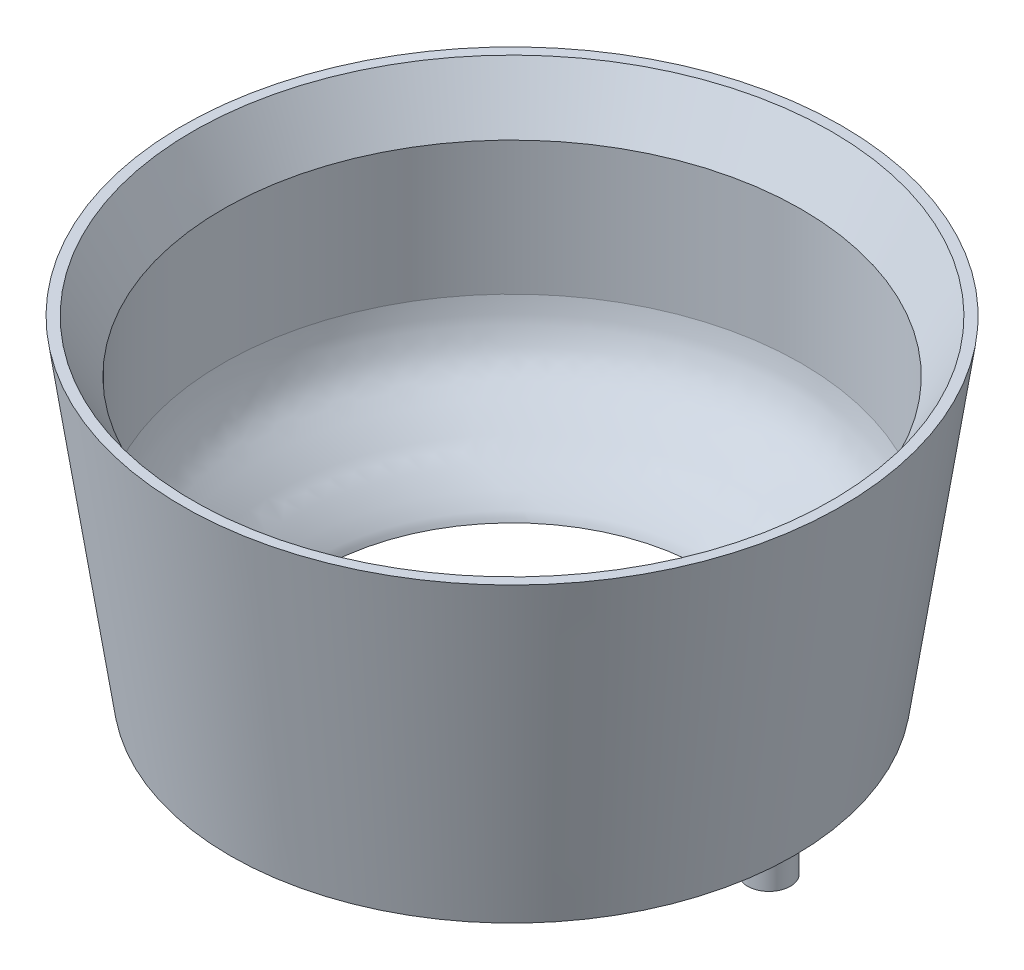
from build123d import *
from OCP.BRepAlgoAPI import BRepAlgoAPI_Cut
from OCP.TopTools import TopTools_ListOfShape

# Parameters (mm, degrees)
SKETCH4_R                       = 3
BOSS_EXTRUDE1_DEPTH             = 2
SKETCH4_2_R                     = 3
BOSS_EXTRUDE3_DEPTH             = 2
BOSS_EXTRUDE3_DIRECTION_2_REACH = 82.882
SKETCH13_R                      = 1.5
CUT_EXTRUDE1_DEPTH              = 6
SKETCH14_R                      = 2
CUT_EXTRUDE2_DEPTH              = 0.5
CHAMFER3_SIZE                   = 0.55


with BuildPart() as part:
    # Sketch2 → Revolve6 (revolve)
    with BuildSketch(Plane(origin=(0, 0, 0), x_dir=(0, 0, -1), z_dir=(1, 0, 0))):
        with BuildLine():
            Line((26.5077562, 274.996982717), (26.5077562, 273.848618937))
            Line((26.5077562, 273.848618937), (39.220771912, 273.848618937))
            Line((39.220771912, 273.848618937), (46.181267187, 321.561079724))
            Line((46.181267187, 321.561079724), (44.775299462, 321.561079724))
            Line((44.775299462, 321.561079724), (40.547674755, 314.238618937))
            Line((40.547674755, 314.238618937), (40.547674755, 295.540718438))
            add(Edge.make_bspline(
                [(40.547674755, 295.540718438), (40.447740466, 295.012709616), (40.292777353, 293.970757619), (39.930889755, 292.587532753), (39.516186416, 291.581451359), (39.108370782, 290.57804728), (38.439698054, 289.316986818), (37.331416086, 288.032583079), (36.368363881, 287.115418474), (35.630231264, 286.340079673), (35.016472726, 285.762737126), (34.394259795, 285.247169223), (33.635524662, 284.556557999), (32.920361334, 283.771384038), (32.129651901, 282.986073936), (31.485241784, 282.459482323), (30.914997208, 281.963476573), (30.371700346, 281.391298159), (29.782796159, 280.80462685), (29.227584581, 280.262154528), (28.724752618, 279.674853681), (28.180386253, 279.039651715), (27.651838315, 278.470209992), (27.308145935, 277.876839187), (26.995230081, 277.127164256), (26.597952618, 276.164510632), (26.464811583, 275.470548141), (26.5077562, 274.996982717)],
                knots=[0, 0, 0, 0, 0.062544048, 0.125088096, 0.156360121, 0.187632145, 0.250176193, 0.312720241, 0.375264289, 0.406536313, 0.437808337, 0.469080362, 0.500352386, 0.562896434, 0.594168458, 0.625440482, 0.656712506, 0.68798453, 0.719256554, 0.750528579, 0.781800603, 0.813072627, 0.844344651, 0.875616675, 0.906888699, 0.938160723, 1.000704771, 1.000704771, 1.000704771, 1.000704771], degree=3))
        make_face()
    revolve(axis=Axis((0, 5, 0), (0, 1, 0)))

    # Sketch4 → Boss-Extrude1 (add)
    with BuildSketch(Plane.XZ.offset(-273.848618937)):
        with Locations(Location((-31.176914536, 18, 0), (0, 0, 270))):
            Circle(SKETCH4_R)
        with Locations(Location((36, 0, 0), (0, 0, 270))):
            Circle(SKETCH4_R)
    extrude(amount=BOSS_EXTRUDE1_DEPTH)

    # Sketch7 → Revolve7 (revolve)
    with BuildSketch(Plane(origin=(0, 0, 0), x_dir=(0, 0, -1), z_dir=(1, 0, 0))):
        with BuildLine():
            Line((39.220771912, 273.848618937), (39.220771912, 272.319355593))
            ThreePointArc((39.220771912, 272.319355593), (32.873157949, 273.157923648), (26.5077562, 273.848618937))
            Line((26.5077562, 273.848618937), (26.5077562, 274.348618937))
            Line((26.5077562, 274.348618937), (39.220771912, 274.348618937))
            Line((39.220771912, 274.348618937), (39.220771912, 273.848618937))
        make_face()
    revolve(axis=Axis((0, 5, 0), (0, 1, 0)))


with BuildPart() as cut_revolve3_tool:
    # Sketch12 → Cut-Revolve3 (revolve)
    with BuildSketch(Plane(origin=(0, 0, 0), x_dir=(0, 0, -1), z_dir=(1, 0, 0))):
        with BuildLine():
            Line((26.0877562, 277.404557538), (26.0877562, 267.404557538))
            Line((26.0877562, 267.404557538), (40.0877562, 267.404557538))
            Line((40.0877562, 267.404557538), (40.0877562, 275.730375326))
            ThreePointArc((40.0877562, 275.730375326), (33.098343341, 276.655999187), (26.0877562, 277.404557538))
        make_face()
    revolve(axis=Axis((0, 5, 0), (0, 1, 0)))


with BuildPart() as part_1:
    add(part.part)

    # Cut-Revolve3: cut by cut_revolve3_tool, with a tolerance
    cut_revolve3_stock = TopTools_ListOfShape()
    cut_revolve3_stock.Append(part_1.part.wrapped)
    cut_revolve3_tools = TopTools_ListOfShape()
    cut_revolve3_tools.Append(cut_revolve3_tool.part.wrapped)
    cut_revolve3_cut = BRepAlgoAPI_Cut()
    cut_revolve3_cut.SetArguments(cut_revolve3_stock)
    cut_revolve3_cut.SetTools(cut_revolve3_tools)
    cut_revolve3_cut.SetFuzzyValue(0.00001)
    cut_revolve3_cut.Build()
    add(Compound.cast(cut_revolve3_cut.Shape()).solids(), mode=Mode.REPLACE)

    # Sketch4<2> → Boss-Extrude3 (add)
    with BuildSketch(Plane.XZ.offset(-273.848618937)):
        with Locations(Location((-31.176914536, 18, 0), (0, 0, 270))):
            Circle(SKETCH4_2_R)
        with Locations(Location((36, 0, 0), (0, 0, 270))):
            Circle(SKETCH4_2_R)
    extrude(amount=BOSS_EXTRUDE3_DEPTH)

    # Sketch4<2> → Boss-Extrude3 direction 2 (add, up to next)
    with BuildSketch(Plane.XZ.offset(-273.848618937), mode=Mode.PRIVATE) as boss_extrude3_direction_2_sk1:
        with Locations(Location((-31.176914536, 18, 0), (0, 0, 270))):
            Circle(SKETCH4_2_R)
    boss_extrude3_direction_2_tool1 = extrude(boss_extrude3_direction_2_sk1.sketch, amount=-BOSS_EXTRUDE3_DIRECTION_2_REACH, mode=Mode.PRIVATE) - part_1.part
    # Sketch4<2> → Boss-Extrude3 direction 2 (add, up to next)
    with BuildSketch(Plane.XZ.offset(-273.848618937), mode=Mode.PRIVATE) as boss_extrude3_direction_2_sk2:
        with Locations(Location((36, 0, 0), (0, 0, 270))):
            Circle(SKETCH4_2_R)
    boss_extrude3_direction_2_tool2 = extrude(boss_extrude3_direction_2_sk2.sketch, amount=-BOSS_EXTRUDE3_DIRECTION_2_REACH, mode=Mode.PRIVATE) - part_1.part
    add(boss_extrude3_direction_2_tool1.solids().sort_by_distance((-31.176915, 273.848619, 18))[0])
    add(boss_extrude3_direction_2_tool2.solids().sort_by_distance((36, 273.848619, 0))[0])

    # Sketch13 → Cut-Extrude1 (cut)
    with BuildSketch(Plane.XZ.offset(-271.848618937)):
        with Locations(Location((-31.176914536, 18, 0), (0, 0, 270))):
            Circle(SKETCH13_R)
        with Locations(Location((36, 0, 0), (0, 0, 270))):
            Circle(SKETCH13_R)
    extrude(amount=-CUT_EXTRUDE1_DEPTH, mode=Mode.SUBTRACT)

    # Sketch14 → Cut-Extrude2 (cut)
    with BuildSketch(Plane.XZ.offset(-271.848618937)):
        with Locations(Location((-31.176914536, 18, 0), (0, 0, 270))):
            Circle(SKETCH14_R)
        with Locations(Location((36, 0, 0), (0, 0, 270))):
            Circle(SKETCH14_R)
    extrude(amount=-CUT_EXTRUDE2_DEPTH, mode=Mode.SUBTRACT)

    # Chamfer3
    # the kernel refuses this chamfer: 0.55 mm, written as the material it takes off along each edge
    with BuildSketch(Plane(origin=(36, 271.848618937, 0), x_dir=(0, 0, -1), z_dir=(-1, 0, 0))) as chamfer3_piece_1_section:
        Polygon((2 + CHAMFER3_SIZE, 0), (2, -CHAMFER3_SIZE), (2, 0), align=None)
    chamfer3_piece_1 = revolve(axis=Axis((36, 271.848618937, 0), (0, -1, 0)), mode=Mode.PRIVATE)
    chamfer3_piece_1 = split(chamfer3_piece_1, bisect_by=Plane(origin=(36, 272.348618937, 0), z_dir=(0, -1, 0)), keep=Keep.TOP, mode=Mode.PRIVATE)
    add(chamfer3_piece_1, mode=Mode.SUBTRACT)
    with BuildSketch(Plane(origin=(-31.176914536, 271.848618937, 18), x_dir=(0, 0, -1), z_dir=(-1, 0, 0))) as chamfer3_piece_2_section:
        Polygon((2 + CHAMFER3_SIZE, 0), (2, -CHAMFER3_SIZE), (2, 0), align=None)
    chamfer3_piece_2 = revolve(axis=Axis((-31.176914536, 271.848618937, 18), (0, -1, 0)), mode=Mode.PRIVATE)
    chamfer3_piece_2 = split(chamfer3_piece_2, bisect_by=Plane(origin=(-31.176914536, 272.348618937, 18), z_dir=(0, -1, 0)), keep=Keep.TOP, mode=Mode.PRIVATE)
    add(chamfer3_piece_2, mode=Mode.SUBTRACT)


solid = part_1.part
